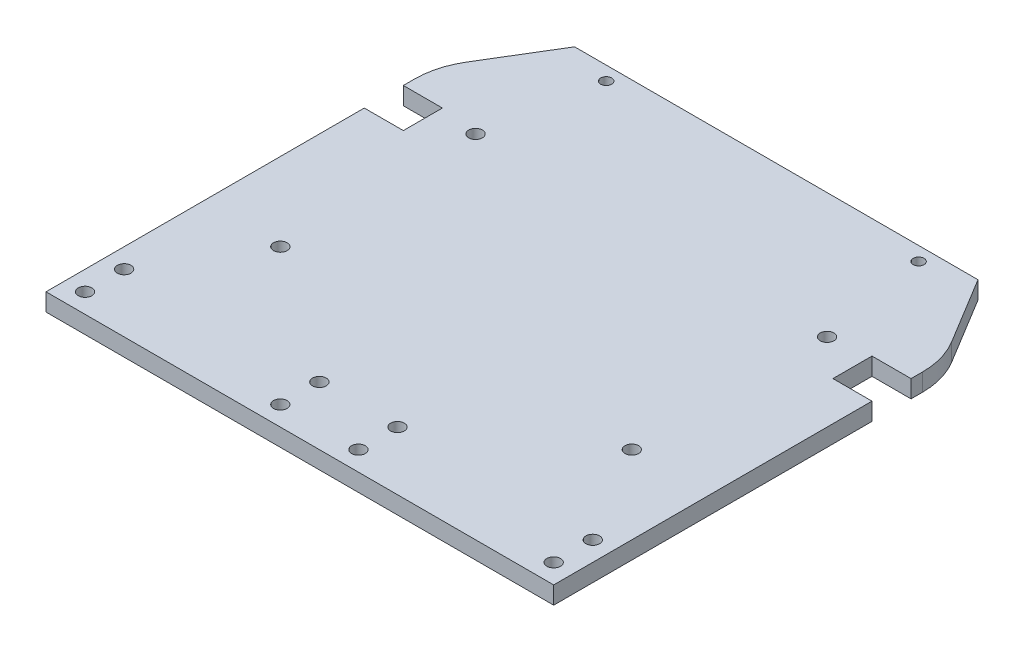
from build123d import *

# Parameters (mm, degrees)
EXTRUDE_1_DEPTH     = 4.5
FILLET_1_R          = 20
SKETCH_2_W          = 10
SKETCH_2_H          = 10
CUT_EXTRUDE_1_DEPTH = 100.349131853
SKETCH_3_R          = 1.75
SKETCH_3_R_2        = 1.4
CUT_EXTRUDE_2_DEPTH = 100.349131853


with BuildPart() as part:
    # 스케치1 → 보스-돌출1 (new body)
    with BuildSketch(Plane(origin=(0, 0, 0), x_dir=(1, 0, 0), z_dir=(0, 1, 0))):
        Polygon((-65, 25), (-51.646992596, 47), (51.646992596, 47), (65, 25), (65, -75), (-65, -75), align=None)
    extrude(amount=EXTRUDE_1_DEPTH)

    # 필렛1
    fillet_1_edges = [part.edges().sort_by_distance(p)[0] for p in [
        (65, 2.25, -25),
        (-65, 2.25, -25),
    ]]
    fillet(fillet_1_edges, radius=FILLET_1_R)

    # 스케치2 → 컷-돌출1 (cut, through all)
    with BuildSketch(Plane(origin=(0, 4.5, 0), x_dir=(1, 0, 0), z_dir=(0, 1, 0))):
        with Locations((-60, 11.5)):
            Rectangle(SKETCH_2_W, SKETCH_2_H)
        with Locations((60, 11.5)):
            Rectangle(SKETCH_2_W, SKETCH_2_H)
    extrude(amount=-CUT_EXTRUDE_1_DEPTH, mode=Mode.SUBTRACT)

    # 스케치3 → 컷-돌출2 (cut, through all)
    with BuildSketch(Plane(origin=(0, 4.5, 0), x_dir=(1, 0, 0), z_dir=(0, 1, 0))):
        with Locations((-60, -60)):
            Circle(SKETCH_3_R)
        with Locations((-60, -70)):
            Circle(SKETCH_3_R)
        with Locations((60, -60)):
            Circle(SKETCH_3_R)
        with Locations((60, -70)):
            Circle(SKETCH_3_R)
        with Locations((-10, -60)):
            Circle(SKETCH_3_R)
        with Locations((10, -60)):
            Circle(SKETCH_3_R)
        with Locations((-10, -70)):
            Circle(SKETCH_3_R)
        with Locations((10, -70)):
            Circle(SKETCH_3_R)
        with Locations((-45, 15)):
            Circle(SKETCH_3_R)
        with Locations((45, 15)):
            Circle(SKETCH_3_R)
        with Locations((-45, -35)):
            Circle(SKETCH_3_R)
        with Locations((45, -35)):
            Circle(SKETCH_3_R)
        with Locations((-40, 43.44)):
            Circle(SKETCH_3_R_2)
        with Locations((40, 43.44)):
            Circle(SKETCH_3_R_2)
    extrude(amount=-CUT_EXTRUDE_2_DEPTH, mode=Mode.SUBTRACT)


solid = part.part
